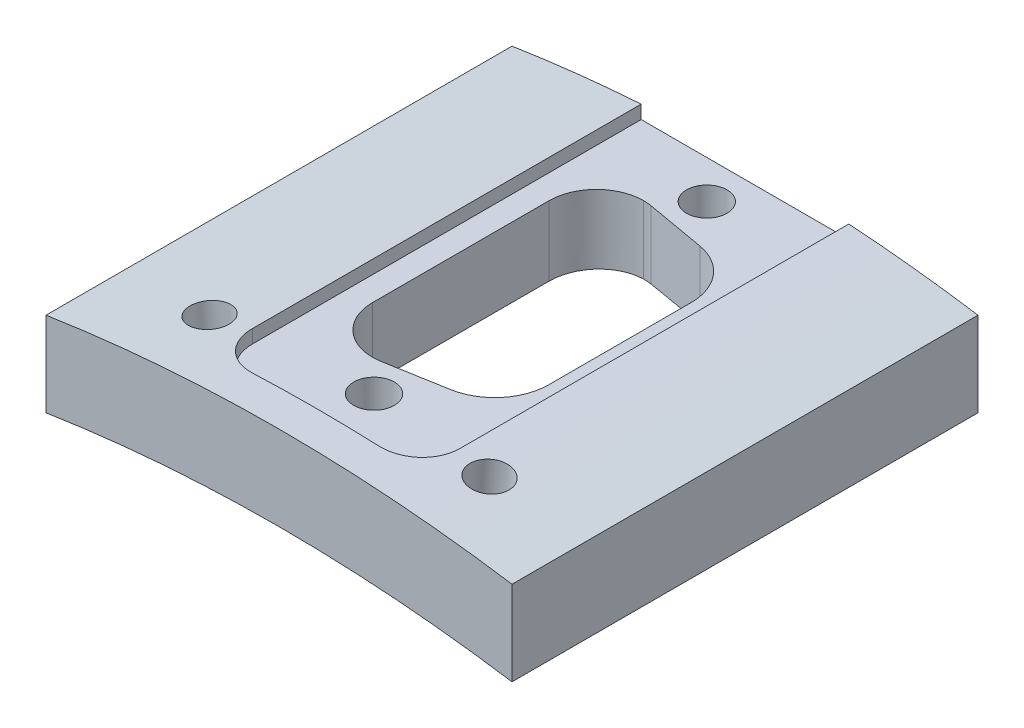
from build123d import *

# Parameters (mm, degrees)
BOSS_EXTRUDE1_DEPTH     = 35
CUT_EXTRUDE4_DEPTH      = 51.280392475
CUT_EXTRUDE4_DEPTH_BACK = 51.280392475
SKETCH6_R               = 1.4732
CUT_EXTRUDE5_DEPTH      = 51.935908437
CUT_EXTRUDE5_DEPTH_BACK = 51.935908437
SKETCH7_R               = 1.4732
CUT_EXTRUDE6_DEPTH      = 52.100782935
CUT_EXTRUDE8_DEPTH      = 1.27
CUT_EXTRUDE9_DEPTH      = 40.880823427
SKETCH10_5_R            = 1.524
CUT_EXTRUDE10_DEPTH     = 40.880823427


with BuildPart() as part:
    # Sketch1 → Boss-Extrude1 (new body)
    with BuildSketch(Plane.XY):
        with BuildLine():
            Line((0, -12.7), (0, 0))
            Line((0, 0), (-35, 0))
            Line((-35, 0), (-35, -12.7))
            ThreePointArc((-35, -12.7), (-17.5, -11.353892856), (0, -12.7))
        make_face()
    extrude(amount=BOSS_EXTRUDE1_DEPTH)

    # Sketch6 → Cut-Extrude4 (cut, two sides: drawn at the far end of the back side and taken through both)
    with BuildSketch(Plane(origin=(-1.080773401, -12.353296496, 0), x_dir=(0.9961946980917455, -0.08715574274765824, 0), z_dir=(-0.08715574274765824, -0.9961946980917455, 0)).offset(-CUT_EXTRUDE4_DEPTH_BACK)):
        with Locations((-6.482080767, 29.70276)):
            Circle(SKETCH6_R)
    extrude(amount=CUT_EXTRUDE4_DEPTH + CUT_EXTRUDE4_DEPTH_BACK, mode=Mode.SUBTRACT)

    # Sketch7 → Cut-Extrude5 (cut, two sides: drawn at the far end of the back side and taken through both)
    with BuildSketch(Plane(origin=(0.814909078, -9.314453387, 0), x_dir=(0.9961946980917455, 0.08715574274765851, 0), z_dir=(0.08715574274765851, -0.9961946980917455, 0)).offset(-CUT_EXTRUDE5_DEPTH_BACK)):
        with Locations((-28.384733667, 29.70276)):
            Circle(SKETCH7_R)
    extrude(amount=CUT_EXTRUDE5_DEPTH + CUT_EXTRUDE5_DEPTH_BACK, mode=Mode.SUBTRACT)

    # Sketch8 → Cut-Extrude6 (cut, through all)
    with BuildSketch(Plane(origin=(0, 0, 0), x_dir=(-1, 0, 0), z_dir=(0, 0, -1))):
        with BuildLine():
            ThreePointArc((0, -6.35), (17.5, -5.003892856), (35, -6.35))
            Line((35, -6.35), (35, 0))
            Line((35, 0), (0, 0))
            Line((0, 0), (0, -6.35))
        make_face()
    extrude(amount=-CUT_EXTRUDE6_DEPTH, mode=Mode.SUBTRACT)

    # Sketch10 → Cut-Extrude8 (cut)
    with BuildSketch(Plane(origin=(-17.5, -5.003892856, 0), x_dir=(-1, 0, 0), z_dir=(0, 1, 0))):
        with BuildLine():
            ThreePointArc((-4.7498, 32.258), (-6.905061469, 31.365261469), (-7.7978, 29.21))
            Line((-7.7978, 29.21), (-7.7978, -3.202561621))
            Line((-7.7978, -3.202561621), (7.7978, -3.202561621))
            Line((7.7978, -3.202561621), (7.7978, 29.21))
            ThreePointArc((7.7978, 29.21), (6.905061469, 31.365261469), (4.7498, 32.258))
            Line((4.7498, 32.258), (-4.7498, 32.258))
        make_face()
    extrude(amount=-CUT_EXTRUDE8_DEPTH, mode=Mode.SUBTRACT)

    # Sketch10<4> → Cut-Extrude9 (cut, through all)
    with BuildSketch(Plane(origin=(-17.5, -5.003892856, 0), x_dir=(-1, 0, 0), z_dir=(0, 1, 0))):
        with BuildLine():
            Line((-2.623406194, 6.019283634), (1.80820708, 5.237870646))
            ThreePointArc((1.80820708, 5.237870646), (2.115785447, 5.197507469), (2.4257, 5.183847016))
            add(Edge.make_bspline(
                [(5.9817, 8.739847016), (5.981497601, 8.061319062), (5.732027199, 7.430902228), (5.461229526, 6.746590943), (4.940171714, 6.225375302), (4.41985898, 5.704904964), (3.734644787, 5.433519817), (3.104763039, 5.184049575), (2.4257, 5.183847016)],
                knots=[0, 0, 0, 0.25, 0.25, 0.5, 0.5, 0.75, 0.75, 1, 1, 1], degree=2))
            Line((5.9817, 8.739847016), (5.9817, 21.994152984))
            add(Edge.make_bspline(
                [(1.80820708, 25.496129354), (2.187374201, 25.56286718), (2.571476781, 25.547163698), (2.964801477, 25.531083183), (3.346060524, 25.428985223), (3.726315442, 25.32715616), (4.075958961, 25.144038913), (4.41629702, 24.965795173), (4.71145274, 24.718207024), (5.005796268, 24.471300174), (5.241167622, 24.166312755), (5.481673474, 23.854672202), (5.648530491, 23.496983523), (5.814948053, 23.140236897), (5.899418625, 22.754688925), (5.981582089, 22.379671256), (5.9817, 21.994152984)],
                knots=[0, 0, 0, 0.125, 0.125, 0.25, 0.25, 0.375, 0.375, 0.5, 0.5, 0.625, 0.625, 0.75, 0.75, 0.875, 0.875, 1, 1, 1], degree=2))
            Line((1.80820708, 25.496129354), (-2.623406194, 24.714716366))
            add(Edge.make_bspline(
                [(-5.9817, 20.712457658), (-5.981516875, 21.406361953), (-5.751621043, 22.060473026), (-5.506558727, 22.75773654), (-5.030904617, 23.324746503), (-4.555908488, 23.890972112), (-3.910989389, 24.254052413), (-3.307247307, 24.593950638), (-2.623406194, 24.714716366)],
                knots=[0, 0, 0, 0.25, 0.25, 0.5, 0.5, 0.75, 0.75, 1, 1, 1], degree=2))
            Line((-5.9817, 20.712457658), (-5.9817, 10.021542342))
            add(Edge.make_bspline(
                [(-2.623406194, 6.019283634), (-3.306736724, 6.139959194), (-3.910989389, 6.479947587), (-4.555105278, 6.842365395), (-5.030904617, 7.409253497), (-5.506045774, 7.975357413), (-5.751621043, 8.673526974), (-5.981516738, 9.327119564), (-5.9817, 10.021542342)],
                knots=[0, 0, 0, 0.25, 0.25, 0.5, 0.5, 0.75, 0.75, 1, 1, 1], degree=2))
        make_face()
    extrude(amount=-CUT_EXTRUDE9_DEPTH, mode=Mode.SUBTRACT)

    # Sketch10<5> → Cut-Extrude10 (cut, through all)
    with BuildSketch(Plane(origin=(-17.5, -5.003892856, 0), x_dir=(-1, 0, 0), z_dir=(0, 1, 0))):
        with Locations((0, 27.8638)):
            Circle(SKETCH10_5_R)
        with Locations((0, 2.8702)):
            Circle(SKETCH10_5_R)
    extrude(amount=-CUT_EXTRUDE10_DEPTH, mode=Mode.SUBTRACT)


solid = part.part
